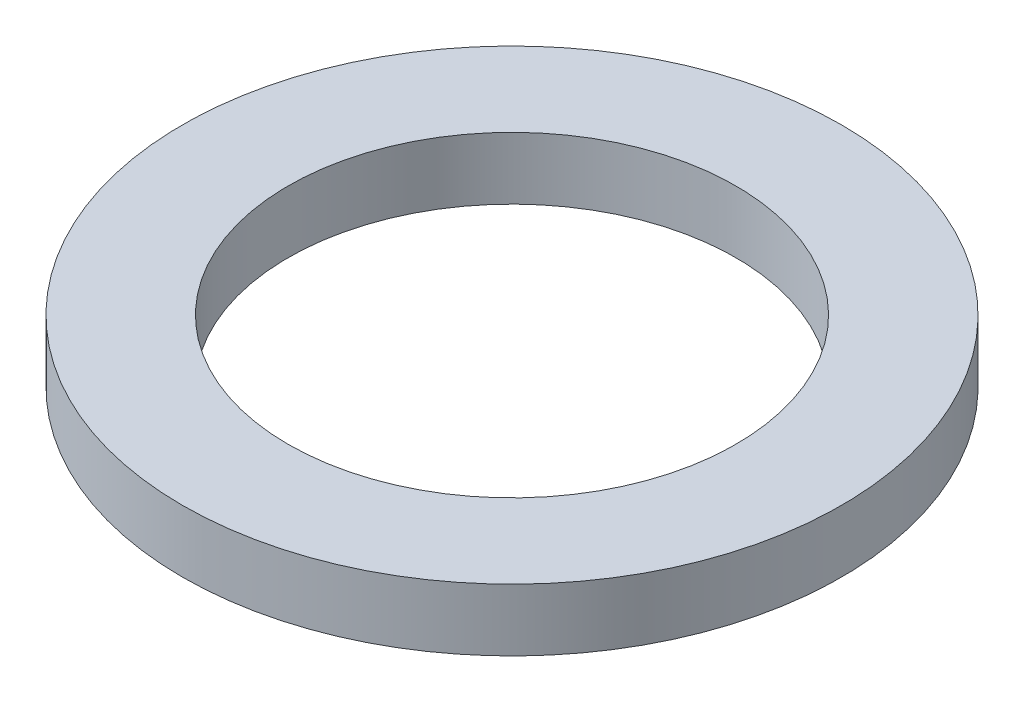
from build123d import *

# Parameters (mm, degrees)
SKETCH1_R           = 6.731
SKETCH1_R_2         = 4.572
BOSS_EXTRUDE1_DEPTH = 1.27


with BuildPart() as part:
    # Sketch1 → Boss-Extrude1 (new body)
    with BuildSketch(Plane(origin=(0, 0, 0), x_dir=(1, 0, 0), z_dir=(0, 1, 0))):
        Circle(SKETCH1_R)
        Circle(SKETCH1_R_2, mode=Mode.SUBTRACT)
    extrude(amount=BOSS_EXTRUDE1_DEPTH)


solid = part.part
